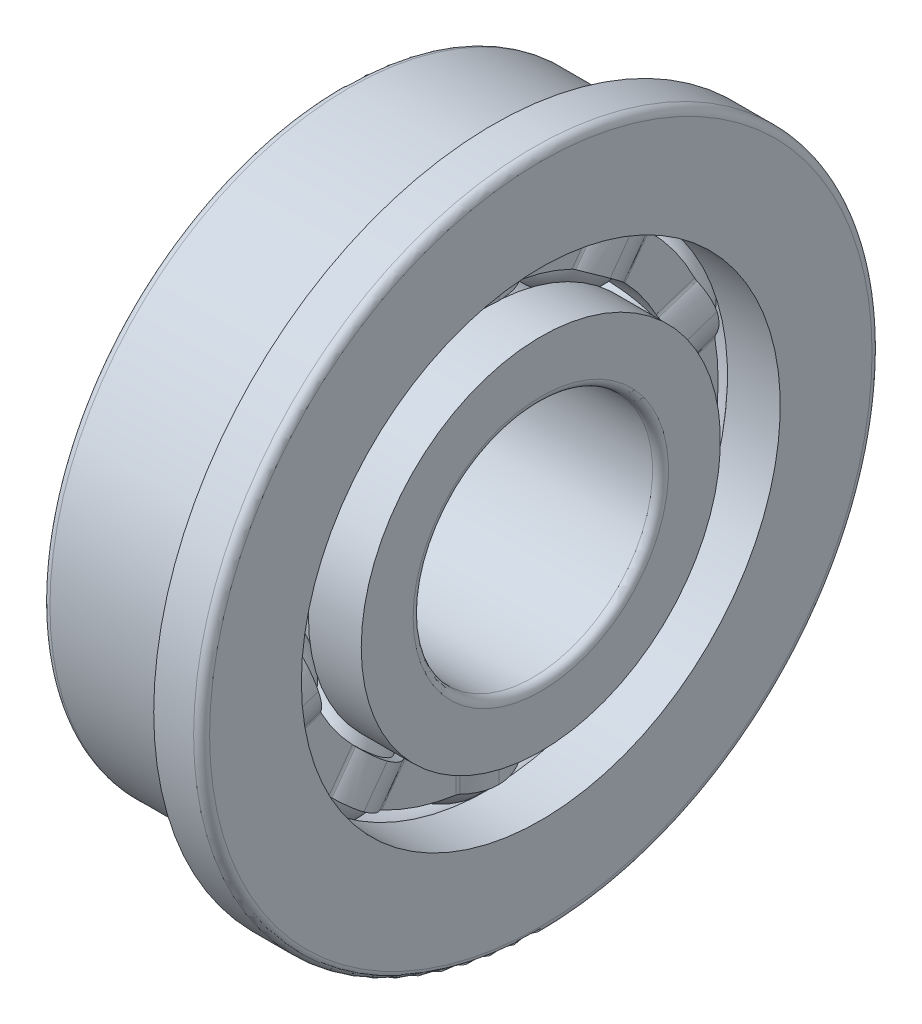
from build123d import *

# Parameters (mm, degrees)
SKETCH10_W                = 2.893219588
SKETCH10_H                = 1
PATTERN_BALL_COUNT        = 10
COSMETIC_FILLET_OUTER_1_R = 0.2
COSMETIC_FILLET_OUTER_2_R = 0.2
COSMETIC_FILLET_INNER_1_R = 0.2
COSMETIC_FILLET_INNER_2_R = 0.2


with BuildPart() as part:
    # Sketch7 → Body-Ball (revolve)
    with BuildSketch(Plane.XY):
        with BuildLine():
            Line((-1.35, 5.25), (1.35, 5.25))
            ThreePointArc((1.35, 5.25), (0, 3.9), (-1.35, 5.25))
        make_face()
    body_ball = revolve(axis=Axis((-1.35, 5.25, 0), (1, 0, 0)))

    # Sketch10 → Body-Ball-Cage (revolve)
    with BuildSketch(Plane.XY, mode=Mode.PRIVATE) as body_ball_cage_sk:
        with Locations((0, 5.25)):
            Rectangle(SKETCH10_W, SKETCH10_H)
    revolve(body_ball_cage_sk.sketch.rotate(Axis((-2.5, 0, 0), (1, 0, 0)), 90), axis=Axis((-2.5, 0, 0), (1, 0, 0)))

    # Sketch16 for Cut-Ball-Cag → Cut-Ball-Cage-1 section 0
    with BuildSketch(Plane(origin=(0, 3.440198759, 1.117788336), x_dir=(-1, 0, 0), z_dir=(-3.491481338843134e-15, 0.9510565162951534, 0.3090169943749483))):
        with BuildLine():
            Line((1.194082626, -0.311834748), (1.194082626, 0.311834748))
            # circular arc as an exact rational Bezier (weights 1, cos(half-angle), 1)
            Bezier((1.194082626, 0.311834748), (1.194082626, 0.35743336), (1.218652177, 0.395846515), weights=[1, 0.959796701, 1])
            Bezier((1.218652177, 0.395846515), (1.446609794, 0.752245839), (1.446609794, 1.17531221), weights=[1, 0.959796701, 1])
            Line((1.446609794, 1.17531221), (1.446609794, -1.17531221))
            Bezier((1.446609794, -1.17531221), (1.446609794, -0.752245839), (1.218652177, -0.395846515), weights=[1, 0.959796701, 1])
            Bezier((1.218652177, -0.395846515), (1.194082626, -0.35743336), (1.194082626, -0.311834748), weights=[1, 0.959796701, 1])
        make_face()
    # Sketch17 for Cut-Ball-Cag → Cut-Ball-Cage-1 section 1
    with BuildSketch(Plane(origin=(0, 6.057140461, 1.968084239), x_dir=(1, 0, 0), z_dir=(-3.4914813388431337e-15, -0.9510565162951533, -0.30901699437494834))):
        with BuildLine():
            Line((-1.194082626, -1.20588877), (-1.194082626, 1.20588877))
            Bezier((-1.194082626, 1.20588877), (-1.194082626, 1.251487381), (-1.218652177, 1.289900536), weights=[1, 0.959796701, 1])
            Bezier((-1.218652177, 1.289900536), (-1.446609794, 1.646299861), (-1.446609794, 2.069366231), weights=[1, 0.959796701, 1])
            Line((-1.446609794, 2.069366231), (-1.446609794, -2.069366231))
            Bezier((-1.446609794, -2.069366231), (-1.446609794, -1.646299861), (-1.218652177, -1.289900536), weights=[1, 0.959796701, 1])
            Bezier((-1.218652177, -1.289900536), (-1.194082626, -1.251487381), (-1.194082626, -1.20588877), weights=[1, 0.959796701, 1])
        make_face()
    cut_ball_cage_1 = loft(mode=Mode.SUBTRACT)

    # Sketch15 for Cut-Ball-Cag → Cut-Ball-Cage-2 section 0
    with BuildSketch(Plane(origin=(0, 6.057140461, 1.968084239), x_dir=(1, 0, 0), z_dir=(-3.4914813388431337e-15, -0.9510565162951533, -0.30901699437494834))):
        with BuildLine():
            Line((1.194082626, -1.20588877), (1.194082626, 1.20588877))
            Bezier((1.194082626, 1.20588877), (1.194082626, 1.251487381), (1.218652177, 1.289900536), weights=[1, 0.959796701, 1])
            Bezier((1.218652177, 1.289900536), (1.446609794, 1.646299861), (1.446609794, 2.069366231), weights=[1, 0.959796701, 1])
            Line((1.446609794, 2.069366231), (1.446609794, -2.069366231))
            Bezier((1.446609794, -2.069366231), (1.446609794, -1.646299861), (1.218652177, -1.289900536), weights=[1, 0.959796701, 1])
            Bezier((1.218652177, -1.289900536), (1.194082626, -1.251487381), (1.194082626, -1.20588877), weights=[1, 0.959796701, 1])
        make_face()
    # Sketch14 for Cut-Ball-Cag → Cut-Ball-Cage-2 section 1
    with BuildSketch(Plane(origin=(0, 3.440198759, 1.117788336), x_dir=(-1, 0, 0), z_dir=(-3.491481338843134e-15, 0.9510565162951534, 0.3090169943749483))):
        with BuildLine():
            Line((-1.194082626, -0.311834748), (-1.194082626, 0.311834748))
            Bezier((-1.194082626, 0.311834748), (-1.194082626, 0.35743336), (-1.218652177, 0.395846515), weights=[1, 0.959796701, 1])
            Bezier((-1.218652177, 0.395846515), (-1.446609794, 0.752245839), (-1.446609794, 1.17531221), weights=[1, 0.959796701, 1])
            Line((-1.446609794, 1.17531221), (-1.446609794, -1.17531221))
            Bezier((-1.446609794, -1.17531221), (-1.446609794, -0.752245839), (-1.218652177, -0.395846515), weights=[1, 0.959796701, 1])
            Bezier((-1.218652177, -0.395846515), (-1.194082626, -0.35743336), (-1.194082626, -0.311834748), weights=[1, 0.959796701, 1])
        make_face()
    cut_ball_cage_2 = loft(mode=Mode.SUBTRACT)

    # Pattern-Ball: Body-Ball, Cut-Ball-Cage-1, Cut-Ball-Cage-2 ×10 about axis
    pattern_ball_axis = Axis((-1.1, 0, 0), (1, 0, 0))
    add([body_ball.rotate(pattern_ball_axis, i * 360 / PATTERN_BALL_COUNT) for i in range(1, PATTERN_BALL_COUNT)])
    add([cut_ball_cage_1.rotate(pattern_ball_axis, i * 360 / PATTERN_BALL_COUNT) for i in range(1, PATTERN_BALL_COUNT)], mode=Mode.SUBTRACT)
    add([cut_ball_cage_2.rotate(pattern_ball_axis, i * 360 / PATTERN_BALL_COUNT) for i in range(1, PATTERN_BALL_COUNT)], mode=Mode.SUBTRACT)

    # Sketch2 → Body-Inner (revolve)
    with BuildSketch(Plane.XY, mode=Mode.PRIVATE) as body_inner_sk:
        with BuildLine():
            Line((-2.5, 4.5), (-2.5, 3))
            Line((-2.5, 3), (2.5, 3))
            Line((2.5, 3), (2.5, 4.5))
            Line((2.5, 4.5), (1.177593691, 4.5))
            ThreePointArc((1.177593691, 4.5), (0, 3.955096475), (-1.177593691, 4.5))
            Line((-1.177593691, 4.5), (-2.5, 4.5))
        make_face()
    revolve(body_inner_sk.sketch.rotate(Axis((-2.5, 0, 0), (1, 0, 0)), 81.955749996), axis=Axis((-2.5, 0, 0), (1, 0, 0)))

    # Sketch8 → Body-Outer (revolve)
    with BuildSketch(Plane.XY, mode=Mode.PRIVATE) as body_outer_sk:
        with BuildLine():
            Line((1.3, 8.5), (1.3, 7.5))
            Line((1.3, 7.5), (-2.5, 7.5))
            Line((-2.5, 7.5), (-2.5, 6))
            Line((-2.5, 6), (-1.177593691, 6))
            ThreePointArc((-1.177593691, 6), (0, 6.544903525), (1.177593691, 6))
            Line((1.177593691, 6), (2.5, 6))
            Line((2.5, 6), (2.5, 8.5))
            Line((2.5, 8.5), (1.3, 8.5))
        make_face()
    revolve(body_outer_sk.sketch.rotate(Axis((-2.5, 0, 0), (1, 0, 0)), 90), axis=Axis((-2.5, 0, 0), (1, 0, 0)))

    # Cosmetic-Fillet-Outer-1
    cosmetic_fillet_outer_1_edges = [part.edges().sort_by_distance(p)[0] for p in [
        (-2.5, 0, -7.5),
    ]]
    fillet(cosmetic_fillet_outer_1_edges, radius=COSMETIC_FILLET_OUTER_1_R)

    # Cosmetic-Fillet-Outer-2
    cosmetic_fillet_outer_2_edges = [part.edges().sort_by_distance(p)[0] for p in [
        (2.5, 0, -8.5),
    ]]
    fillet(cosmetic_fillet_outer_2_edges, radius=COSMETIC_FILLET_OUTER_2_R)

    # Cosmetic-Fillet-Inner-1
    cosmetic_fillet_inner_1_edges = [part.edges().sort_by_distance(p)[0] for p in [
        (-2.5, -0.419813555, -2.970480867),
    ]]
    fillet(cosmetic_fillet_inner_1_edges, radius=COSMETIC_FILLET_INNER_1_R)

    # Cosmetic-Fillet-Inner-2
    cosmetic_fillet_inner_2_edges = [part.edges().sort_by_distance(p)[0] for p in [
        (2.5, -0.419813555, -2.970480867),
    ]]
    fillet(cosmetic_fillet_inner_2_edges, radius=COSMETIC_FILLET_INNER_2_R)


solid = part.part
